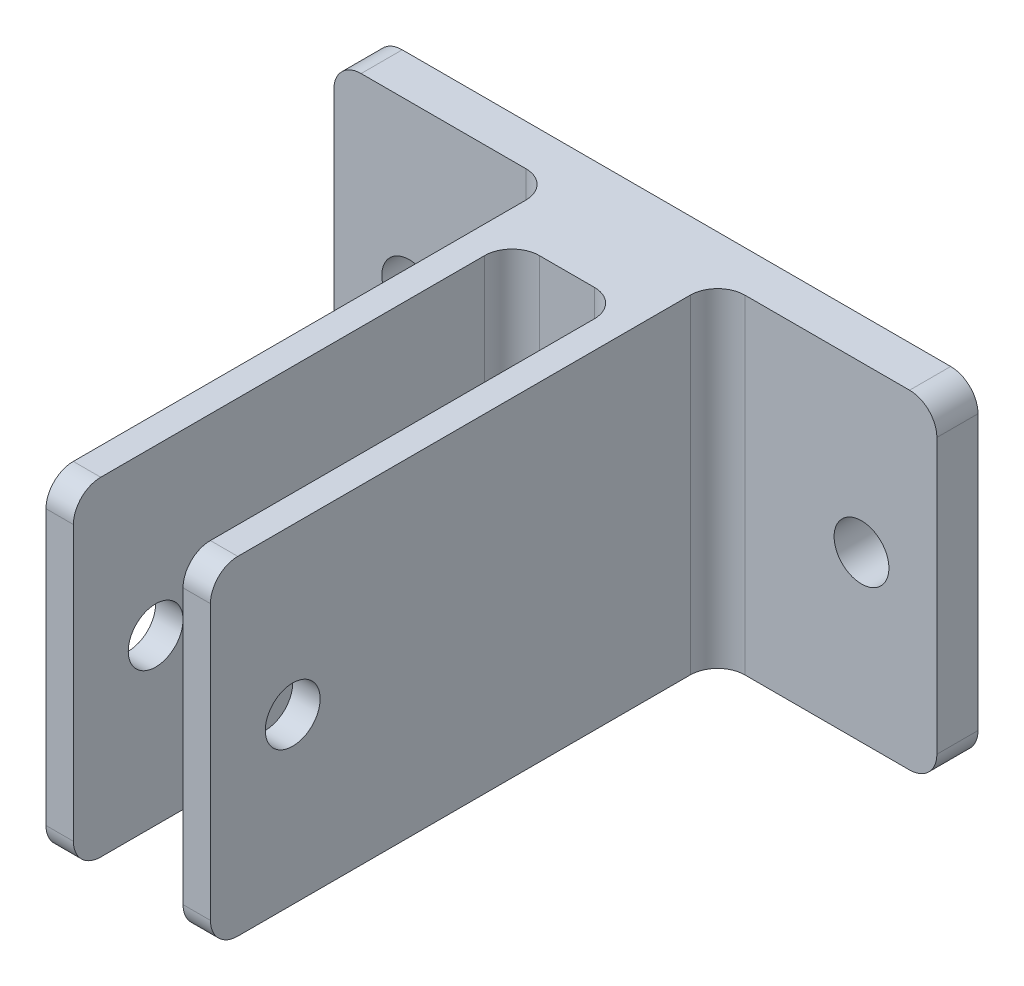
from build123d import *

# Parameters (mm, degrees)
EXTRUDE1_DEPTH      = 19.05
SKETCH2_R           = 3.175
EXTRUDE2_DEPTH      = 75.93269063
EXTRUDE3_DEPTH      = 76.501141892
EXTRUDE3_DEPTH_BACK = 76.501141892
SKETCH3_R           = 3.175
FILLET3_R           = 3.1623


with BuildPart() as part:
    # Sketch1 → Extrude1 (new, symmetric)
    with BuildSketch(Plane(origin=(0, 0, 0), x_dir=(1, 0, 0), z_dir=(0, 1, 0))):
        Polygon((-34.925, 0), (34.925, 0), (34.925, -4.7625), (9.525, -4.7625), (9.525, -63.5), (6.35, -63.5), (6.35, -12.7), (-6.35, -12.7), (-6.35, -63.5), (-9.525, -63.5), (-9.525, -4.7625), (-34.925, -4.7625), align=None)
    extrude(amount=EXTRUDE1_DEPTH, both=True)

    # Sketch2 → Extrude2 (cut, through all)
    with BuildSketch(Plane.XY):
        with Locations((-26.19375, 0)):
            Circle(SKETCH2_R)
        with Locations((26.19375, 0)):
            Circle(SKETCH2_R)
    extrude(amount=EXTRUDE2_DEPTH, mode=Mode.SUBTRACT)

    # Sketch3 → Extrude3 (cut, two sides: drawn at the far end of the back side and taken through both)
    with BuildSketch(Plane(origin=(0, 0, -0.669808337), x_dir=(0, 0, -1), z_dir=(1, 0, 0)).offset(-EXTRUDE3_DEPTH_BACK)):
        with Locations((-54.644808337, 0)):
            Circle(SKETCH3_R)
    extrude(amount=EXTRUDE3_DEPTH + EXTRUDE3_DEPTH_BACK, mode=Mode.SUBTRACT)

    # Fillet3
    fillet3_edges = [part.edges().sort_by_distance(p)[0] for p in [
        (9.525, 0, 4.7625),
        (7.9375, -19.05, 63.5),
        (7.9375, 19.05, 63.5),
        (6.35, 0, 12.7),
        (-6.35, 0, 12.7),
        (-7.9375, -19.05, 63.5),
        (-7.9375, 19.05, 63.5),
        (34.925, -19.05, 2.38125),
        (34.925, 19.05, 2.38125),
        (-34.925, -19.05, 2.38125),
        (-34.925, 19.05, 2.38125),
        (-9.525, 0, 4.7625),
    ]]
    fillet(fillet3_edges, radius=FILLET3_R)


solid = part.part
